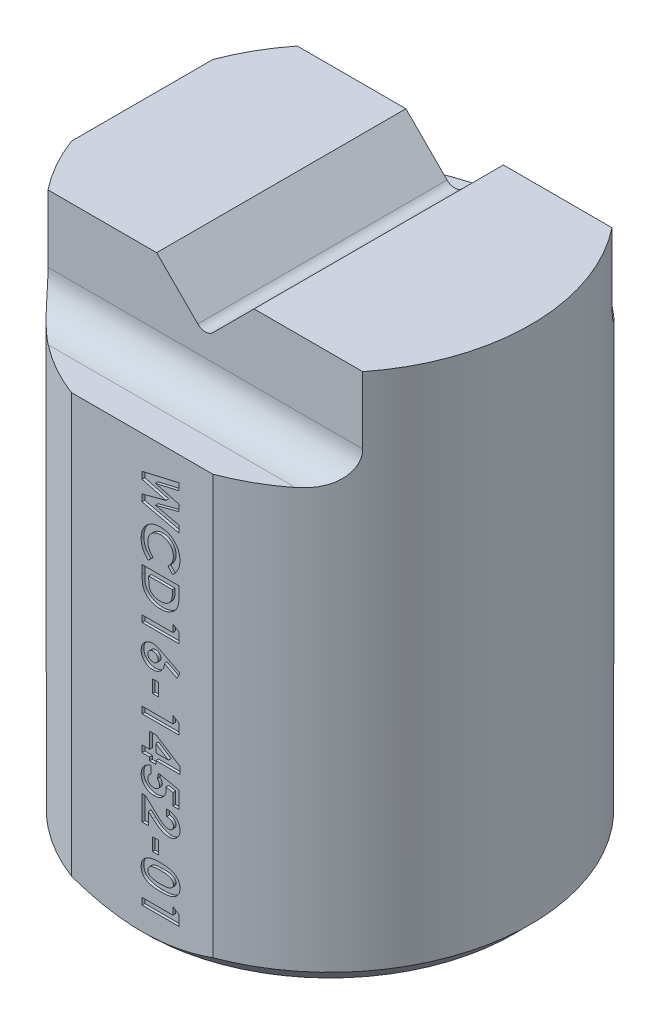
from build123d import *

# Parameters (mm, degrees)
SALIENTE_EXTRUIR1_DEPTH = 50.8
CORTAR_EXTRUIR1_DEPTH   = 66.566945218
CORTAR_EXTRUIR2_DEPTH   = 63.397192666
CHAFL_N1_SIZE           = 1.5875
CROQUIS4_W              = 0.583333334
CROQUIS4_H              = 1.211538461
CORTAR_EXTRUIR3_DEPTH   = 0.254


with BuildPart() as part:
    # Croquis1 → Saliente-Extruir1 (new body)
    with BuildSketch(Plane(origin=(0, 0, 0), x_dir=(1, 0, 0), z_dir=(0, 1, 0))):
        with BuildLine():
            Line((-17.8054, 6.700980227), (-17.8054, -6.700980227))
            ThreePointArc((-17.8054, -6.700980227), (-13.452423669, -13.452423669), (-6.700980227, -17.8054))
            Line((-6.700980227, -17.8054), (6.700980227, -17.8054))
            ThreePointArc((6.700980227, -17.8054), (13.452423669, 13.452423669), (-17.8054, 6.700980227))
        make_face()
    extrude(amount=SALIENTE_EXTRUIR1_DEPTH)

    # Croquis2 → Cortar-Extruir1 (cut, through all)
    with BuildSketch(Plane(origin=(-17.8054, 0, 0), x_dir=(0, 0, -1), z_dir=(1, 0, 0))):
        with BuildLine():
            Line((11.811, 50.8), (11.811, 44.45))
            ThreePointArc((11.811, 44.45), (12.74093597, 42.20493597), (14.986, 41.275))
            Line((14.986, 41.275), (19.0246, 41.275))
            Line((19.0246, 41.275), (19.0246, 50.8))
            Line((19.0246, 50.8), (11.811, 50.8))
        make_face()
        with BuildLine():
            Line((-19.0246, 50.8), (-11.811, 50.8))
            Line((-11.811, 50.8), (-11.811, 44.45))
            ThreePointArc((-11.811, 44.45), (-12.74093597, 42.20493597), (-14.986, 41.275))
            Line((-14.986, 41.275), (-19.0246, 41.275))
            Line((-19.0246, 41.275), (-19.0246, 50.8))
        make_face()
    extrude(amount=CORTAR_EXTRUIR1_DEPTH, mode=Mode.SUBTRACT)

    # Croquis3 → Cortar-Extruir2 (cut, through all)
    with BuildSketch(Plane.XY.offset(11.811)):
        with BuildLine():
            Line((-4.615851646, 50.8), (-0.71842049, 46.902568843))
            ThreePointArc((-0.71842049, 46.902568843), (0, 46.604989333), (0.71842049, 46.902568843))
            Line((0.71842049, 46.902568843), (4.615851646, 50.8))
            Line((4.615851646, 50.8), (-4.615851646, 50.8))
        make_face()
    extrude(amount=-CORTAR_EXTRUIR2_DEPTH, mode=Mode.SUBTRACT)

    # Chaflán1
    chafl_n1_edges = [part.edges().sort_by_distance(p)[0] for p in [
        (13.452423669, 0, -13.452423669),
    ]]
    chamfer(chafl_n1_edges, length=CHAFL_N1_SIZE)
    chafl_n1_2_edges = [part.edges().sort_by_distance(p)[0] for p in [
        (-13.452423669, 0, 13.452423669),
    ]]
    chamfer(chafl_n1_2_edges, length=CHAFL_N1_SIZE - 0.0001)  # a hair under: the kernel refuses the full size

    # Croquis4 → Cortar-Extruir3 (cut)
    # profile 1 of 13: a face of its own
    with BuildSketch(Plane.XY.offset(17.8054)):
        Polygon((3.5, 38.967628205), (3.5, 38.319090545), (1.26552484, 37.800961538), (3.5, 37.207111378), (3.5, 36.596434295), (1.26552484, 36.006089744), (3.5, 35.489362981), (3.5, 34.839423077), (0, 35.64921875), (0, 36.30546875), (2.262520032, 36.903525641), (0, 37.505088141), (0, 38.156430288), align=None)
    # profile 2 of 13: a face of its own
    with BuildSketch(Plane.XY.offset(17.8054)):
        with BuildLine():
            Line((2.892828526, 31.1375), (2.452524038, 31.598137019))
            add(Edge.make_bspline(
                [(2.452524038, 31.598137019), (2.492979524, 31.637170164), (2.572130399, 31.713538238), (2.675863197, 31.837118733), (2.763657071, 31.964490199), (2.836680847, 32.094796132), (2.89238701, 32.230047491), (2.93243686, 32.368464151), (2.957375261, 32.510798563), (2.960143016, 32.606950737), (2.961538462, 32.655428686)],
                knots=[0, 0, 0, 0, 1.115306757, 2.182089883, 3.196083701, 4.1824169, 5.141279108, 6.092660653, 7.038358735, 8, 8, 8, 8], degree=3))
            add(Edge.make_bspline(
                [(2.961538462, 32.655428686), (2.960417785, 32.695909815), (2.958206253, 32.775794864), (2.941993543, 32.893087048), (2.914423124, 33.005283085), (2.876425979, 33.112767038), (2.82725969, 33.215222632), (2.766962311, 33.312864677), (2.696078413, 33.405452441), (2.614974752, 33.491762893), (2.526362907, 33.570716661), (2.431814281, 33.640477342), (2.331545478, 33.698913103), (2.226571947, 33.746870382), (2.116407818, 33.784227248), (2.00112726, 33.810904744), (1.88059298, 33.826334294), (1.798654675, 33.828637258), (1.757011218, 33.829807692)],
                knots=[0, 0, 0, 0, 1.035432265, 2.043311493, 3.022114605, 3.98653278, 4.95457646, 5.923598177, 6.917315552, 7.932509744, 8.948865224, 9.949768934, 10.933144597, 11.912367597, 12.897413939, 13.903909035, 14.934704909, 16, 16, 16, 16], degree=3))
            add(Edge.make_bspline(
                [(1.757011218, 33.829807692), (1.727782778, 33.829470816), (1.670172922, 33.828806826), (1.584954517, 33.821522842), (1.502262614, 33.809826582), (1.422268601, 33.792784102), (1.344662956, 33.771853521), (1.269466523, 33.745841133), (1.196724484, 33.714948931), (1.12657402, 33.680052115), (1.059824514, 33.640667682), (0.996460477, 33.597207297), (0.937288684, 33.54924508), (0.88028502, 33.499021827), (0.828853399, 33.443135332), (0.780011923, 33.384181834), (0.735421452, 33.320906027), (0.693872229, 33.254723726), (0.657782788, 33.185035396), (0.625091416, 33.113739338), (0.598541484, 33.039752533), (0.577139731, 32.963976356), (0.55894076, 32.886681457), (0.547735089, 32.807111862), (0.539249168, 32.725957327), (0.538725212, 32.671110484), (0.538461538, 32.643509615)],
                knots=[0, 0, 0, 0, 1.103757074, 2.175527871, 3.227929046, 4.25632503, 5.262816555, 6.262237806, 7.259082723, 8.246028863, 9.219500025, 10.184246818, 11.145149257, 12.095245763, 13.050780899, 14.010384931, 14.985255937, 15.972438916, 16.959582425, 17.947317807, 18.933039374, 19.924907969, 20.920697008, 21.929431285, 22.958016685, 24, 24, 24, 24], degree=3))
            add(Edge.make_bspline(
                [(0.538461538, 32.643509615), (0.539817719, 32.596694485), (0.542482261, 32.504714926), (0.56325883, 32.369709945), (0.597644399, 32.240898309), (0.637843765, 32.137813751), (0.677644891, 32.057193711), (0.714973074, 31.996371904), (0.756009935, 31.933059587), (0.803284918, 31.868657145), (0.855874443, 31.802460459), (0.915002606, 31.735680998), (0.97870158, 31.666596612), (1.024165677, 31.621340609), (1.047475962, 31.598137019)],
                knots=[0, 0, 0, 0, 1.404522537, 2.759521553, 4.088271485, 5.398566954, 6.072955186, 6.783849712, 7.538645654, 8.336900766, 9.180343671, 10.075042757, 11.013038782, 12, 12, 12, 12], degree=3))
            Line((1.047475962, 31.598137019), (0.578425481, 31.151522436))
            add(Edge.make_bspline(
                [(0.578425481, 31.151522436), (0.548114978, 31.182917037), (0.488955358, 31.244192584), (0.404954238, 31.336625052), (0.329469819, 31.428941166), (0.259762693, 31.518910869), (0.197862411, 31.608007578), (0.143711292, 31.696223168), (0.095925279, 31.782554387), (0.055360592, 31.868810154), (0.020697132, 31.955675175), (-0.008536317, 32.045012484), (-0.034055114, 32.136864768), (-0.054137091, 32.231992751), (-0.07048521, 32.32997198), (-0.081287688, 32.431117299), (-0.088778526, 32.534956123), (-0.089419276, 32.605167776), (-0.08974359, 32.640705128)],
                knots=[0, 0, 0, 0, 1.244537013, 2.429070097, 3.56066612, 4.644477994, 5.67429546, 6.652817684, 7.595405349, 8.486886006, 9.369351459, 10.26090686, 11.166404474, 12.086719576, 13.0323422, 13.998023148, 14.9867073, 16, 16, 16, 16], degree=3))
            add(Edge.make_bspline(
                [(-0.08974359, 32.640705128), (-0.088076654, 32.705980326), (-0.084814924, 32.833705743), (-0.06073091, 33.020902058), (-0.020087909, 33.198881066), (0.036611619, 33.367962569), (0.110235654, 33.527629107), (0.19956996, 33.678381397), (0.305462418, 33.819968389), (0.426335327, 33.951171742), (0.559857392, 34.069814233), (0.703168522, 34.174799001), (0.85729787, 34.26126045), (1.018943889, 34.334618545), (1.190633727, 34.389589294), (1.37081597, 34.429603154), (1.560263841, 34.45395138), (1.689630923, 34.456641064), (1.755608974, 34.458012821)],
                knots=[0, 0, 0, 0, 1.07798487, 2.109316747, 3.111276023, 4.08905949, 5.049398091, 6.009992678, 6.978127636, 7.964347882, 8.951383687, 9.924270623, 10.892397886, 11.86520058, 12.851549246, 13.863953586, 14.910602472, 16, 16, 16, 16], degree=3))
            add(Edge.make_bspline(
                [(1.755608974, 34.458012821), (1.798636408, 34.457407916), (1.883906264, 34.456209144), (2.009629506, 34.444609881), (2.131830903, 34.426365787), (2.250134535, 34.40127829), (2.365199642, 34.368914293), (2.47626848, 34.329138706), (2.583801292, 34.281775798), (2.687110508, 34.227034578), (2.786768715, 34.166428659), (2.881038016, 34.098439982), (2.970932337, 34.025151646), (3.055281654, 33.944756846), (3.13441781, 33.858350333), (3.209311214, 33.766170135), (3.278558749, 33.667102287), (3.342500577, 33.562571347), (3.400908825, 33.454218516), (3.451128993, 33.342801508), (3.494305026, 33.229344983), (3.529436028, 33.113897574), (3.555863311, 32.995924275), (3.575825508, 32.876376954), (3.586993704, 32.754265126), (3.588821121, 32.672276654), (3.58974359, 32.630889423)],
                knots=[0, 0, 0, 0, 1.072042128, 2.124525481, 3.143421661, 4.149789678, 5.136208088, 6.119957821, 7.087418232, 8.061778743, 9.031690376, 9.991741907, 10.955971237, 11.919971873, 12.892764515, 13.874218568, 14.877632952, 15.902487591, 16.926514439, 17.94307752, 18.945815567, 19.949956505, 20.947454389, 21.956649761, 22.968530506, 24, 24, 24, 24], degree=3))
            add(Edge.make_bspline(
                [(3.58974359, 32.630889423), (3.589214692, 32.595581941), (3.588162395, 32.525334076), (3.579390354, 32.420723217), (3.565613953, 32.316948987), (3.544828298, 32.214382929), (3.520153099, 32.112291386), (3.487844329, 32.012015955), (3.451830117, 31.911974737), (3.408782479, 31.81373673), (3.361792095, 31.717164809), (3.308479797, 31.624521322), (3.252126365, 31.534250794), (3.189396556, 31.448353565), (3.122565697, 31.365220597), (3.051321984, 31.285286597), (2.974477576, 31.209253034), (2.920182466, 31.161538592), (2.892828526, 31.1375)],
                knots=[0, 0, 0, 0, 0.996412454, 1.982464992, 2.961075852, 3.949442424, 4.934965278, 5.923860011, 6.921385422, 7.934793307, 8.949617135, 9.951082467, 10.950285876, 11.951772932, 12.951063433, 13.960125323, 14.972308753, 16, 16, 16, 16], degree=3))
        make_face()
    # profile 3 of 13: a face of its own
    with BuildSketch(Plane.XY.offset(17.8054)):
        with BuildLine():
            Line((3.5, 30.509294872), (3.5, 29.717728365))
            add(Edge.make_bspline(
                [(3.5, 29.717728365), (3.499568591, 29.656016661), (3.498734672, 29.53672724), (3.489339229, 29.363900309), (3.474888157, 29.203193825), (3.455013137, 29.05450167), (3.428696427, 28.918137098), (3.395741478, 28.794248065), (3.357455945, 28.682308902), (3.312963548, 28.581004707), (3.260756274, 28.4887806), (3.202110394, 28.401830656), (3.13613819, 28.319152527), (3.062688192, 28.240287642), (2.982248191, 28.165043911), (2.893198621, 28.095187589), (2.79784594, 28.02847914), (2.695859214, 27.966000913), (2.587439788, 27.910387489), (2.474294106, 27.860885305), (2.356348631, 27.819641046), (2.233766215, 27.786058506), (2.106901952, 27.759308156), (1.975514115, 27.740586743), (1.839720404, 27.729014174), (1.747686487, 27.727840146), (1.700921474, 27.72724359)],
                knots=[0, 0, 0, 0, 1.443473934, 2.790251435, 4.047465151, 5.217279069, 6.298047006, 7.293970747, 8.213772908, 9.063072335, 9.878180301, 10.689410498, 11.514196541, 12.349783386, 13.208549609, 14.087984609, 14.994942826, 15.929749014, 16.883358292, 17.843153412, 18.816615524, 19.8034191, 20.814532747, 21.847477555, 22.906243002, 24, 24, 24, 24], degree=3))
            add(Edge.make_bspline(
                [(1.700921474, 27.72724359), (1.63493291, 27.728805539), (1.505030559, 27.731880327), (1.314401533, 27.757783426), (1.13166008, 27.799670677), (0.958256772, 27.858591799), (0.795659909, 27.931555461), (0.647126596, 28.018938456), (0.512354038, 28.118230651), (0.39357849, 28.230313159), (0.29086397, 28.351479513), (0.203922209, 28.477889092), (0.13413216, 28.609428337), (0.09056056, 28.725578069), (0.063150713, 28.826575295), (0.047312403, 28.915127839), (0.032225651, 29.015841033), (0.021020219, 29.129362559), (0.010749742, 29.2555452), (0.005237984, 29.394476259), (0.000634556, 29.545922723), (0.000217061, 29.651117288), (0, 29.705809295)],
                knots=[0, 0, 0, 0, 1.315357893, 2.589359008, 3.828307697, 5.048525571, 6.235260212, 7.375784434, 8.478395391, 9.566323578, 10.624275077, 11.640246088, 12.619991216, 13.585951757, 14.107079058, 14.704817694, 15.378369799, 16.137463096, 16.978827496, 17.902494345, 18.909479843, 20, 20, 20, 20], degree=3))
            Line((0, 29.705809295), (0, 30.509294872))
            Line((0, 30.509294872), (3.5, 30.509294872))
        make_face()
        with BuildLine():
            Line((2.871794872, 29.881089744), (0.628205128, 29.881089744))
            Line((0.628205128, 29.881089744), (0.628205128, 29.552964744))
            add(Edge.make_bspline(
                [(0.628205128, 29.552964744), (0.628276669, 29.513922908), (0.628414266, 29.43883246), (0.63496812, 29.330418852), (0.641546381, 29.230163754), (0.654032142, 29.138343143), (0.667940402, 29.05428878), (0.687295649, 28.97915535), (0.707626696, 28.911394027), (0.733510639, 28.851832503), (0.76264474, 28.797279), (0.796778717, 28.746768689), (0.834683209, 28.698012088), (0.877473052, 28.651920786), (0.924581586, 28.608320167), (0.9762517, 28.567468853), (1.032325129, 28.528819027), (1.093100774, 28.493372761), (1.157927403, 28.4609512), (1.226213671, 28.432307593), (1.29833184, 28.408127144), (1.374249989, 28.389764449), (1.453497013, 28.374121852), (1.536582444, 28.362826697), (1.623234838, 28.356673058), (1.682215613, 28.355860811), (1.712139423, 28.355448718)],
                knots=[0, 0, 0, 0, 1.502785267, 2.890356349, 4.180881464, 5.369512404, 6.456827674, 7.458527365, 8.354953631, 9.177280646, 9.954299195, 10.732931168, 11.52132839, 12.330004022, 13.151395147, 13.990341431, 14.86389591, 15.771318928, 16.696852441, 17.652725226, 18.620174565, 19.621874256, 20.657747019, 21.729235313, 22.847930884, 24, 24, 24, 24], degree=3))
            add(Edge.make_bspline(
                [(1.712139423, 28.355448718), (1.75799226, 28.356285848), (1.847401739, 28.357918186), (1.977628596, 28.373660105), (2.100256692, 28.399284947), (2.214830919, 28.435849127), (2.321673292, 28.481939408), (2.419878629, 28.53963214), (2.511096645, 28.606444448), (2.56460806, 28.659277799), (2.591346154, 28.685677083)],
                knots=[0, 0, 0, 0, 1.13821349, 2.219428113, 3.251817212, 4.244760574, 5.201143372, 6.134805572, 7.068016741, 8, 8, 8, 8], degree=3))
            add(Edge.make_bspline(
                [(2.591346154, 28.685677083), (2.614130624, 28.711709277), (2.660665325, 28.764877086), (2.716425797, 28.858222287), (2.765416837, 28.961083864), (2.804261268, 29.075814981), (2.834981101, 29.201306813), (2.856167818, 29.338306792), (2.869782177, 29.486081254), (2.8711096, 29.588455958), (2.871794872, 29.64130609)],
                knots=[0, 0, 0, 0, 0.813307809, 1.661089106, 2.549956539, 3.493439533, 4.508053171, 5.589449661, 6.755572447, 8, 8, 8, 8], degree=3))
            Line((2.871794872, 29.64130609), (2.871794872, 29.881089744))
        make_face(mode=Mode.SUBTRACT)
    # profile 4 of 13: a face of its own
    with BuildSketch(Plane.XY.offset(17.8054)):
        Polygon((3.5, 26.723938301), (3.5, 25.752884615), (0, 25.752884615), (0, 26.381089744), (2.916666667, 26.381089744), (2.916666667, 27.099038462), align=None)
    # profile 5 of 13: a face of its own
    with BuildSketch(Plane.XY.offset(17.8054)):
        with BuildLine():
            Line((3.58974359, 23.388701923), (3.307892628, 22.83271234))
            Line((3.307892628, 22.83271234), (2.108974359, 23.442688301))
            add(Edge.make_bspline(
                [(2.108974359, 23.442688301), (2.108041348, 23.406651494), (2.106203629, 23.335671092), (2.091350882, 23.231237833), (2.065674043, 23.131397693), (2.031639463, 23.035143989), (1.985930683, 22.943653331), (1.931557705, 22.855452211), (1.86524401, 22.772822437), (1.791771954, 22.693869378), (1.710375475, 22.622077767), (1.622912373, 22.559714061), (1.531510636, 22.505365192), (1.434125384, 22.463116568), (1.33237089, 22.429037421), (1.225840396, 22.404447817), (1.114225415, 22.39041876), (1.038400302, 22.388484621), (0.999799679, 22.3875)],
                knots=[0, 0, 0, 0, 1.013260694, 1.995783107, 2.958651975, 3.908806537, 4.861209129, 5.829647963, 6.817170299, 7.835534541, 8.860094905, 9.863329007, 10.853101798, 11.844815043, 12.84250023, 13.867713965, 14.914507806, 16, 16, 16, 16], degree=3))
            add(Edge.make_bspline(
                [(0.999799679, 22.3875), (0.962591212, 22.388422995), (0.889046028, 22.390247359), (0.781023541, 22.405318199), (0.677395029, 22.429698068), (0.57830761, 22.464455063), (0.483607295, 22.508896062), (0.392393311, 22.562063057), (0.306677881, 22.626674061), (0.226025072, 22.699727752), (0.152235446, 22.779663641), (0.087358024, 22.864473463), (0.033126312, 22.953766137), (-0.012418212, 23.046395576), (-0.046446274, 23.144035754), (-0.072120187, 23.245275759), (-0.086937705, 23.350869736), (-0.088800811, 23.422544726), (-0.08974359, 23.458814103)],
                knots=[0, 0, 0, 0, 1.049811581, 2.075027318, 3.071773918, 4.050170609, 5.032849337, 6.020452587, 7.024397577, 8.056465645, 9.088112048, 10.090756029, 11.064784855, 12.032427273, 12.998382039, 13.977467781, 14.976547025, 16, 16, 16, 16], degree=3))
            add(Edge.make_bspline(
                [(-0.08974359, 23.458814103), (-0.088969855, 23.496740804), (-0.08744841, 23.57131853), (-0.070412233, 23.680444407), (-0.044766644, 23.785105516), (-0.0081491, 23.884713643), (0.038476396, 23.979888222), (0.096170758, 24.069508744), (0.164297771, 24.154330137), (0.241324685, 24.233448082), (0.325697131, 24.304727454), (0.413297697, 24.368302697), (0.504263848, 24.422087434), (0.598498322, 24.465624925), (0.695700839, 24.499593885), (0.79605588, 24.523229354), (0.899297254, 24.538630042), (0.969362693, 24.540435422), (1.004707532, 24.541346154)],
                knots=[0, 0, 0, 0, 1.063775006, 2.091769615, 3.092589432, 4.084662827, 5.064601646, 6.061867366, 7.070035304, 8.113879863, 9.156342271, 10.166834137, 11.149076039, 12.117706134, 13.076241869, 14.034148791, 15.008317125, 16, 16, 16, 16], degree=3))
            add(Edge.make_bspline(
                [(1.004707532, 24.541346154), (1.032077976, 24.540864941), (1.086971218, 24.539899836), (1.169170865, 24.530201112), (1.251586278, 24.515455645), (1.321131014, 24.498363718), (1.379938366, 24.480764178), (1.429705439, 24.463050107), (1.484936007, 24.441097417), (1.545771109, 24.416002242), (1.612137558, 24.386975428), (1.683854458, 24.354168607), (1.761464902, 24.317500104), (1.81477126, 24.291350412), (1.842548077, 24.277724359)],
                knots=[0, 0, 0, 0, 1.110454016, 2.227089276, 3.35462975, 4.507227546, 5.131400587, 5.845402449, 6.650387134, 7.543487832, 8.516250726, 9.590168902, 10.744287919, 12, 12, 12, 12], degree=3))
            Line((1.842548077, 24.277724359), (3.58974359, 23.388701923))
        make_face()
        with BuildLine():
            add(Edge.make_bspline(
                [(1.525641026, 23.472836538), (1.524258421, 23.502979732), (1.521552845, 23.561966006), (1.493218739, 23.645835667), (1.448769578, 23.722305768), (1.386865525, 23.788590997), (1.312887751, 23.844032493), (1.228506218, 23.884772849), (1.134846975, 23.909280437), (1.069361994, 23.911826619), (1.035556891, 23.913141026)],
                knots=[0, 0, 0, 0, 0.981744412, 1.921144944, 2.858899012, 3.85339082, 4.86292663, 5.863643845, 6.897155691, 8, 8, 8, 8], degree=3))
            add(Edge.make_bspline(
                [(1.035556891, 23.913141026), (1.001748788, 23.911567065), (0.935989767, 23.908505606), (0.841223383, 23.883295426), (0.75527079, 23.840671713), (0.680393914, 23.782451662), (0.617727229, 23.714502847), (0.571951897, 23.638513391), (0.54364568, 23.556334758), (0.540201518, 23.499464062), (0.538461538, 23.470733173)],
                knots=[0, 0, 0, 0, 1.098593804, 2.136838383, 3.163662877, 4.199231707, 5.205701886, 6.153612227, 7.067210972, 8, 8, 8, 8], degree=3))
            add(Edge.make_bspline(
                [(0.538461538, 23.470733173), (0.540235082, 23.440392332), (0.54371331, 23.380888674), (0.570792611, 23.295050744), (0.61603715, 23.21663728), (0.678059004, 23.14730461), (0.752161771, 23.087749164), (0.838966412, 23.046542812), (0.934199894, 23.019938107), (1.001013724, 23.017147757), (1.035556891, 23.015705128)],
                knots=[0, 0, 0, 0, 0.96921794, 1.900804717, 2.848419905, 3.844199796, 4.861108892, 5.867439427, 6.897452859, 8, 8, 8, 8], degree=3))
            add(Edge.make_bspline(
                [(1.035556891, 23.015705128), (1.069373239, 23.0172489), (1.134922146, 23.020241315), (1.228549932, 23.045520061), (1.313139774, 23.086902656), (1.387105723, 23.143904956), (1.449311116, 23.212453938), (1.493218153, 23.292309006), (1.521633261, 23.379791743), (1.524282364, 23.441293675), (1.525641026, 23.472836538)],
                knots=[0, 0, 0, 0, 1.083506644, 2.10024676, 3.086160022, 4.086481818, 5.079696241, 6.033050226, 6.991198733, 8, 8, 8, 8], degree=3))
        make_face(mode=Mode.SUBTRACT)
    # profile 6 of 13: a face of its own
    with BuildSketch(Plane.XY.offset(17.8054)):
        with Locations((1.278846154, 21.018910256)):
            Rectangle(CROQUIS4_W, CROQUIS4_H)
    # profile 7 of 13: a face of its own
    with BuildSketch(Plane.XY.offset(17.8054)):
        Polygon((3.5, 19.230348558), (3.5, 18.259294872), (0, 18.259294872), (0, 18.8875), (2.916666667, 18.8875), (2.916666667, 19.605448718), align=None)
    # profile 8 of 13: a face of its own
    with BuildSketch(Plane.XY.offset(17.8054)):
        Polygon((3.58974359, 15.728245192), (3.58974359, 15.073397436), (1.301282051, 15.073397436), (1.301282051, 14.759294872), (0.717948718, 14.759294872), (0.717948718, 15.073397436), (0, 15.073397436), (0, 15.701602564), (0.717948718, 15.701602564), (0.717948718, 17.182371795), (1.353866186, 17.182371795), align=None)
        Polygon((1.301282051, 15.701602564), (2.492487981, 15.701602564), (1.301282051, 16.476342147), align=None, mode=Mode.SUBTRACT)
    # profile 9 of 13: a face of its own
    with BuildSketch(Plane.XY.offset(17.8054)):
        with BuildLine():
            Line((3.5, 13.750380609), (3.5, 12.156730769))
            Line((3.5, 12.156730769), (2.916666667, 12.156730769))
            Line((2.916666667, 12.156730769), (2.916666667, 13.252584135))
            Line((2.916666667, 13.252584135), (2.254807692, 13.389302885))
            add(Edge.make_bspline(
                [(2.254807692, 13.389302885), (2.260011766, 13.370675673), (2.270337098, 13.33371768), (2.280347931, 13.278322814), (2.287192332, 13.224709009), (2.288045062, 13.189736806), (2.288461538, 13.17265625)],
                knots=[0, 0, 0, 0, 1.054652254, 2.092520994, 3.068380062, 4, 4, 4, 4], degree=3))
            add(Edge.make_bspline(
                [(2.288461538, 13.17265625), (2.287608748, 13.135439912), (2.285927709, 13.062078312), (2.26996917, 12.9547596), (2.244834954, 12.851995593), (2.208988378, 12.754100762), (2.162333132, 12.661170735), (2.105893363, 12.573092863), (2.039569942, 12.489759046), (1.963321345, 12.412649642), (1.879598659, 12.341798302), (1.789043716, 12.280197102), (1.69294774, 12.227585833), (1.590713401, 12.185740649), (1.4829828, 12.152712862), (1.3696869, 12.128846246), (1.250691427, 12.114732723), (1.169509324, 12.112829601), (1.128104968, 12.111858974)],
                knots=[0, 0, 0, 0, 1.01440847, 1.999622559, 2.951875003, 3.895578053, 4.836219714, 5.782137149, 6.743708247, 7.735272588, 8.734977101, 9.730283169, 10.717124674, 11.717316708, 12.737475749, 13.78628267, 14.87096371, 16, 16, 16, 16], degree=3))
            add(Edge.make_bspline(
                [(1.128104968, 12.111858974), (1.08622803, 12.113038059), (1.00359259, 12.115364737), (0.882133217, 12.13073582), (0.765560743, 12.157335285), (0.654525629, 12.195709541), (0.548081434, 12.243174382), (0.446948801, 12.30213349), (0.35083445, 12.371568076), (0.261051547, 12.451318254), (0.178974831, 12.537981251), (0.106775241, 12.630266259), (0.046019009, 12.727513746), (-0.00308208, 12.829728956), (-0.041930045, 12.936324693), (-0.070209494, 13.047333511), (-0.08642619, 13.163294844), (-0.088625639, 13.242017524), (-0.08974359, 13.28203125)],
                knots=[0, 0, 0, 0, 1.06812338, 2.107719657, 3.117068656, 4.112431602, 5.099639003, 6.085279307, 7.092884053, 8.119131772, 9.143854758, 10.133578715, 11.102895672, 12.062725997, 13.020721913, 13.992309192, 14.979516593, 16, 16, 16, 16], degree=3))
            add(Edge.make_bspline(
                [(-0.08974359, 13.28203125), (-0.088829036, 13.317814334), (-0.087025345, 13.388386063), (-0.075938907, 13.492335121), (-0.056337982, 13.592553557), (-0.027970368, 13.68850932), (0.006943689, 13.781212025), (0.050610316, 13.869590002), (0.10219804, 13.954128903), (0.160765386, 14.034588669), (0.226739229, 14.109661945), (0.298958967, 14.178180876), (0.376514305, 14.240560285), (0.460362042, 14.29546535), (0.550378295, 14.34272396), (0.645502204, 14.38463386), (0.746727166, 14.418937533), (0.816901933, 14.436345659), (0.852564103, 14.445192308)],
                knots=[0, 0, 0, 0, 1.054957082, 2.080596141, 3.077793124, 4.061112343, 5.027190972, 5.994718051, 6.962465889, 7.943658696, 8.924948258, 9.904494768, 10.875059, 11.855380583, 12.854004648, 13.869083016, 14.917087635, 16, 16, 16, 16], degree=3))
            Line((0.852564103, 14.445192308), (0.852564103, 13.72724359))
            add(Edge.make_bspline(
                [(0.852564103, 13.72724359), (0.827848753, 13.714121698), (0.779817292, 13.688620799), (0.716096066, 13.640073497), (0.661445198, 13.585740592), (0.616368773, 13.525548753), (0.582220926, 13.460353514), (0.556086292, 13.392339117), (0.541294896, 13.320294157), (0.53941223, 13.27111041), (0.538461538, 13.246274038)],
                knots=[0, 0, 0, 0, 1.105084364, 2.147605349, 3.154024051, 4.144789344, 5.108147638, 6.055727127, 7.018198351, 8, 8, 8, 8], degree=3))
            add(Edge.make_bspline(
                [(0.538461538, 13.246274038), (0.539113117, 13.228961863), (0.540395107, 13.194899867), (0.547172003, 13.144712552), (0.560023964, 13.096815633), (0.577764849, 13.05080985), (0.600183474, 13.006558669), (0.627728605, 12.964284997), (0.660226953, 12.924200704), (0.69715222, 12.886439368), (0.738422612, 12.852356099), (0.782478811, 12.822207493), (0.829282437, 12.7964172), (0.879349498, 12.776370446), (0.932123436, 12.760193315), (0.987670684, 12.748209538), (1.046118918, 12.741064783), (1.086017449, 12.74040213), (1.106370192, 12.740064103)],
                knots=[0, 0, 0, 0, 0.978584799, 1.925382083, 2.854237347, 3.773848163, 4.706917643, 5.651871472, 6.619075428, 7.618203006, 8.630937754, 9.638147826, 10.630884984, 11.643619732, 12.679505692, 13.746568031, 14.850495961, 16, 16, 16, 16], degree=3))
            add(Edge.make_bspline(
                [(1.106370192, 12.740064103), (1.126265678, 12.740347762), (1.165020309, 12.740900305), (1.221615906, 12.748716555), (1.27579543, 12.758510933), (1.32705193, 12.77434388), (1.375957954, 12.79366124), (1.421379426, 12.818915151), (1.465398049, 12.846328442), (1.504819713, 12.87971389), (1.541290984, 12.915001289), (1.573132471, 12.953016974), (1.599572491, 12.993293259), (1.622651701, 13.034610631), (1.639449088, 13.078609963), (1.651016614, 13.124304055), (1.65950446, 13.171644272), (1.660003149, 13.203934029), (1.66025641, 13.220332532)],
                knots=[0, 0, 0, 0, 1.166407123, 2.272056916, 3.347877023, 4.393466184, 5.414668253, 6.42708463, 7.438943561, 8.452102724, 9.450960385, 10.414941083, 11.35441816, 12.274885341, 13.186627518, 14.108013686, 15.039145946, 16, 16, 16, 16], degree=3))
            add(Edge.make_bspline(
                [(1.66025641, 13.220332532), (1.659580522, 13.238145116), (1.658225896, 13.273845355), (1.647203668, 13.326886975), (1.629365569, 13.37928906), (1.604755084, 13.431343021), (1.572547724, 13.482532131), (1.534772184, 13.534207296), (1.488683712, 13.584638837), (1.454356913, 13.616704613), (1.436598558, 13.633293269)],
                knots=[0, 0, 0, 0, 0.88288272, 1.769486374, 2.674910571, 3.623812639, 4.617874466, 5.670434592, 6.794841017, 8, 8, 8, 8], degree=3))
            Line((1.436598558, 13.633293269), (1.557892628, 14.161939103))
            Line((1.557892628, 14.161939103), (3.5, 13.750380609))
        make_face()
    # profile 10 of 13: a face of its own
    with BuildSketch(Plane.XY.offset(17.8054)):
        with BuildLine():
            Line((2.333333333, 10.990064103), (2.333333333, 11.618269231))
            add(Edge.make_bspline(
                [(2.333333333, 11.618269231), (2.380853728, 11.615556109), (2.473705726, 11.610254832), (2.608576225, 11.589167694), (2.736014017, 11.560911651), (2.855573308, 11.523200211), (2.967210656, 11.47581332), (3.071306638, 11.419970364), (3.167313186, 11.354244681), (3.254767303, 11.280035132), (3.333223199, 11.19860159), (3.402787125, 11.111634696), (3.460189525, 11.017804172), (3.507426387, 10.918824381), (3.545166444, 10.814712176), (3.570398727, 10.704482492), (3.587486275, 10.589089757), (3.588981504, 10.510094086), (3.58974359, 10.469831731)],
                knots=[0, 0, 0, 0, 1.199038563, 2.342849363, 3.436047546, 4.486744587, 5.497670872, 6.488682221, 7.459191391, 8.424610317, 9.374430501, 10.305433194, 11.225809216, 12.140057399, 13.06607119, 14.010487599, 14.985989317, 16, 16, 16, 16], degree=3))
            add(Edge.make_bspline(
                [(3.58974359, 10.469831731), (3.588198998, 10.420411346), (3.585183592, 10.323931174), (3.559538073, 10.18371961), (3.516390467, 10.052646709), (3.456703735, 9.930708418), (3.380526719, 9.81936849), (3.288902704, 9.719352217), (3.182150587, 9.631284293), (3.062447571, 9.55685038), (2.935499331, 9.496016264), (2.804764037, 9.452512105), (2.672966082, 9.424106778), (2.584241289, 9.421063255), (2.540164263, 9.419551282)],
                knots=[0, 0, 0, 0, 1.075208937, 2.099059817, 3.090102131, 4.070747506, 5.044426497, 6.016695572, 7.013986309, 8.047248753, 9.078128699, 10.07077592, 11.041593041, 12, 12, 12, 12], degree=3))
            add(Edge.make_bspline(
                [(2.540164263, 9.419551282), (2.513502321, 9.42013848), (2.459838417, 9.421320365), (2.378631761, 9.429538166), (2.295913285, 9.441866487), (2.211753927, 9.460454612), (2.126130033, 9.48363545), (2.038785609, 9.511757457), (1.950214893, 9.545471527), (1.85942487, 9.584220606), (1.76610541, 9.630429711), (1.668921017, 9.684310469), (1.567585289, 9.746979281), (1.462838731, 9.81911646), (1.352410922, 9.897794298), (1.239144983, 9.986744233), (1.121185807, 10.083362478), (1.042387564, 10.152010204), (1.001903045, 10.187279647)],
                knots=[0, 0, 0, 0, 0.728291422, 1.465870735, 2.227967504, 3.011895603, 3.818808047, 4.650669213, 5.517493715, 6.406970765, 7.346374078, 8.360901659, 9.441709605, 10.599840149, 11.834858619, 13.145178554, 14.533265854, 16, 16, 16, 16], degree=3))
            Line((1.001903045, 10.187279647), (0.583333333, 10.552564103))
            Line((0.583333333, 10.552564103), (0.583333333, 9.374679487))
            Line((0.583333333, 9.374679487), (0, 9.374679487))
            Line((0, 9.374679487), (0, 11.708012821))
            Line((0, 11.708012821), (0.318309295, 11.708012821))
            Line((0.318309295, 11.708012821), (1.421173878, 10.671754808))
            add(Edge.make_bspline(
                [(1.421173878, 10.671754808), (1.453344781, 10.641752475), (1.515650278, 10.583646855), (1.60715253, 10.500968545), (1.693985982, 10.426151978), (1.777075237, 10.360748536), (1.853725216, 10.30132593), (1.926246247, 10.250533811), (1.993982712, 10.20790747), (2.075661059, 10.161630531), (2.173077022, 10.117682651), (2.285304206, 10.077357812), (2.392567547, 10.052777031), (2.462462646, 10.049384106), (2.49599359, 10.04775641)],
                knots=[0, 0, 0, 0, 1.246127091, 2.413378631, 3.493388633, 4.492180848, 5.408488754, 6.240484944, 6.999099869, 7.674939598, 8.898438119, 10.020720584, 11.050475521, 12, 12, 12, 12], degree=3))
            add(Edge.make_bspline(
                [(2.49599359, 10.04775641), (2.528441842, 10.048954396), (2.591315534, 10.051275684), (2.680492825, 10.077420614), (2.761846473, 10.116539888), (2.831670598, 10.173333657), (2.889548302, 10.241882284), (2.931960385, 10.321547179), (2.956887977, 10.410865634), (2.959958752, 10.473412664), (2.961538462, 10.505588942)],
                knots=[0, 0, 0, 0, 1.061596218, 2.057012874, 3.024113775, 4.006148568, 4.986025304, 5.949989669, 6.945406325, 8, 8, 8, 8], degree=3))
            add(Edge.make_bspline(
                [(2.961538462, 10.505588942), (2.960950642, 10.522208339), (2.959793424, 10.554926291), (2.952090139, 10.603019123), (2.938513903, 10.648782908), (2.920323658, 10.692727022), (2.896212358, 10.734382482), (2.866491338, 10.77364422), (2.831915879, 10.810925908), (2.792594092, 10.846056557), (2.748710967, 10.878030033), (2.700667285, 10.906428759), (2.64849287, 10.929909776), (2.592876502, 10.950583318), (2.533220817, 10.966527743), (2.469882848, 10.978137262), (2.402965636, 10.986963204), (2.356966346, 10.989011666), (2.333333333, 10.990064103)],
                knots=[0, 0, 0, 0, 0.903469896, 1.778625579, 2.63899355, 3.493148037, 4.358286772, 5.247621495, 6.164656832, 7.118446693, 8.109501108, 9.111810964, 10.146451449, 11.215617525, 12.33435995, 13.498009769, 14.714554818, 16, 16, 16, 16], degree=3))
        make_face()
    # profile 11 of 13: a face of its own
    with BuildSketch(Plane.XY.offset(17.8054)):
        with Locations((1.278846154, 8.050961539)):
            Rectangle(CROQUIS4_W, CROQUIS4_H)
    # profile 12 of 13: a face of its own
    with BuildSketch(Plane.XY.offset(17.8054)):
        with BuildLine():
            add(Edge.make_bspline(
                [(3.58974359, 5.728145032), (3.589292236, 5.697737265), (3.588404754, 5.637947471), (3.57879055, 5.549888896), (3.56427042, 5.46506208), (3.544004841, 5.383144778), (3.517238157, 5.304691735), (3.484924891, 5.22907037), (3.446292458, 5.156916638), (3.401901199, 5.088063632), (3.352254725, 5.022190682), (3.294867932, 4.961489252), (3.232282817, 4.903609802), (3.163466306, 4.849512066), (3.087949341, 4.799801721), (3.00673234, 4.753550819), (2.919050821, 4.711355788), (2.824815419, 4.67265843), (2.722597833, 4.638039898), (2.611214164, 4.60896308), (2.490744257, 4.583684539), (2.360560501, 4.563776978), (2.220969987, 4.54748311), (2.071711506, 4.536836877), (1.913202756, 4.529430624), (1.80446315, 4.528832784), (1.748597756, 4.528525641)],
                knots=[0, 0, 0, 0, 0.879087513, 1.728520926, 2.558587148, 3.366762743, 4.166157112, 4.95337177, 5.74258602, 6.530032775, 7.320866164, 8.124307838, 8.942260106, 9.784645725, 10.652593514, 11.554662219, 12.485739241, 13.464770064, 14.499274465, 15.604285219, 16.792026686, 18.057713884, 19.411711354, 20.855437135, 22.384468668, 24, 24, 24, 24], degree=3))
            add(Edge.make_bspline(
                [(1.748597756, 4.528525641), (1.692033771, 4.528859905), (1.582130963, 4.529509374), (1.422167658, 4.53650699), (1.271841986, 4.548557121), (1.131169704, 4.564088498), (1.000224395, 4.585361211), (0.878669388, 4.610277835), (0.766540671, 4.639875601), (0.66411805, 4.675646354), (0.569659208, 4.71401347), (0.482454166, 4.756621054), (0.400936246, 4.800905311), (0.326241474, 4.849550701), (0.258205639, 4.901523383), (0.19620369, 4.956007436), (0.141089362, 5.014163843), (0.091724504, 5.075122872), (0.048513994, 5.140365801), (0.011390259, 5.209605647), (-0.019289021, 5.283309617), (-0.045732667, 5.3604055), (-0.064757589, 5.442264819), (-0.079840809, 5.527623639), (-0.088179421, 5.617435283), (-0.089213643, 5.678583072), (-0.08974359, 5.709915865)],
                knots=[0, 0, 0, 0, 1.643682949, 3.193646483, 4.651618242, 6.025629174, 7.305184366, 8.505292942, 9.630500342, 10.672179876, 11.655924581, 12.591484594, 13.491256898, 14.350247848, 15.17884557, 15.977481787, 16.746098769, 17.504475725, 18.254166354, 19.016819136, 19.783753977, 20.571954997, 21.382401421, 22.223156612, 23.089526058, 24, 24, 24, 24], degree=3))
            add(Edge.make_bspline(
                [(-0.08974359, 5.709915865), (-0.08920114, 5.741247197), (-0.088138488, 5.802624816), (-0.079928099, 5.892687979), (-0.06456648, 5.978691907), (-0.045853396, 6.061313044), (-0.019146432, 6.139825794), (0.012025309, 6.214803735), (0.049361079, 6.285873595), (0.092379878, 6.353080145), (0.141720926, 6.416180014), (0.196844721, 6.476157497), (0.257614734, 6.532878903), (0.324710754, 6.585481669), (0.397237451, 6.634827072), (0.476022902, 6.680401036), (0.560952715, 6.722174192), (0.652144074, 6.761461109), (0.751565081, 6.795571569), (0.86008357, 6.826031785), (0.978723813, 6.850565666), (1.107040012, 6.872055184), (1.245481839, 6.886484039), (1.393410678, 6.898824303), (1.551283014, 6.905728778), (1.659782862, 6.90639022), (1.715645032, 6.906730769)],
                knots=[0, 0, 0, 0, 0.917197984, 1.796777363, 2.643741708, 3.473481078, 4.273990801, 5.068160217, 5.848535553, 6.620952589, 7.401027954, 8.190319769, 9.003592045, 9.831693788, 10.683727512, 11.569696396, 12.49373307, 13.453184301, 14.474457586, 15.568383184, 16.750575061, 18.019320986, 19.375517054, 20.823796471, 22.364701649, 24, 24, 24, 24], degree=3))
            add(Edge.make_bspline(
                [(1.715645032, 6.906730769), (1.793260909, 6.906121311), (1.943021744, 6.904945353), (2.159413126, 6.890424833), (2.359281241, 6.868459236), (2.542867587, 6.838390022), (2.709812826, 6.797890068), (2.860069005, 6.748187854), (2.995123466, 6.691157894), (3.075143503, 6.642638312), (3.113681891, 6.619270833)],
                knots=[0, 0, 0, 0, 1.288526675, 2.486228817, 3.599112392, 4.626206381, 5.5730174, 6.447949553, 7.252518174, 8, 8, 8, 8], degree=3))
            add(Edge.make_bspline(
                [(3.113681891, 6.619270833), (3.151540942, 6.592094811), (3.225562848, 6.538960334), (3.322739774, 6.446053214), (3.405850239, 6.34623661), (3.47301338, 6.237460346), (3.525978238, 6.121444763), (3.563386721, 5.99719381), (3.585182647, 5.865166323), (3.588200572, 5.774500846), (3.58974359, 5.728145032)],
                knots=[0, 0, 0, 0, 1.058512271, 2.069600068, 3.047294572, 4.004278952, 4.967380941, 5.939006123, 6.946246673, 8, 8, 8, 8], degree=3))
        make_face()
        with BuildLine():
            add(Edge.make_bspline(
                [(2.961538462, 5.712720353), (2.960225557, 5.740204133), (2.957651566, 5.794086932), (2.936168077, 5.872154473), (2.902263792, 5.945439102), (2.862300426, 6.001537967), (2.823311379, 6.043338127), (2.789110775, 6.073633334), (2.749110447, 6.100765783), (2.705039384, 6.126944865), (2.65568472, 6.150237231), (2.6022913, 6.173397959), (2.543076573, 6.192267285), (2.479156529, 6.210850688), (2.408729109, 6.227097375), (2.331240444, 6.240811499), (2.246107861, 6.252637518), (2.153537728, 6.262623196), (2.053161486, 6.268971875), (1.945212834, 6.275115762), (1.829468372, 6.277352367), (1.749765973, 6.278126258), (1.708633814, 6.278525641)],
                knots=[0, 0, 0, 0, 1.076821401, 2.111141558, 3.153197101, 4.23200803, 4.796476379, 5.394298193, 6.020090776, 6.690078086, 7.403703365, 8.159894791, 8.971856079, 9.83973388, 10.771758647, 11.806038152, 12.926526118, 14.143777411, 15.458313878, 16.872423957, 18.385946227, 20, 20, 20, 20], degree=3))
            add(Edge.make_bspline(
                [(1.708633814, 6.278525641), (1.655343729, 6.277885966), (1.553156039, 6.276659341), (1.406211953, 6.270210158), (1.272462209, 6.257357841), (1.151082174, 6.241163683), (1.042532416, 6.219102998), (0.946779237, 6.191634273), (0.863113726, 6.161173113), (0.792766273, 6.122980587), (0.732604762, 6.082060641), (0.680562047, 6.03838505), (0.637209833, 5.991192066), (0.600404668, 5.941892311), (0.573074679, 5.888657541), (0.553150238, 5.832579352), (0.541001834, 5.773533259), (0.539313199, 5.733108504), (0.538461538, 5.712720353)],
                knots=[0, 0, 0, 0, 1.772047989, 3.398033405, 4.888860297, 6.238411839, 7.468309579, 8.567754056, 9.549141588, 10.421774021, 11.221426488, 11.965694757, 12.675067502, 13.348095901, 14.005005053, 14.656328889, 15.322321954, 16, 16, 16, 16], degree=3))
            add(Edge.make_bspline(
                [(0.538461538, 5.712720353), (0.539043617, 5.693031099), (0.540183253, 5.654481989), (0.551881469, 5.598268754), (0.570900227, 5.545109524), (0.597803595, 5.495164804), (0.632015344, 5.448255949), (0.673685815, 5.40461222), (0.723230366, 5.36456277), (0.759999749, 5.341229778), (0.778946314, 5.329206731)],
                knots=[0, 0, 0, 0, 0.992283464, 1.942767638, 2.88273346, 3.832339453, 4.79467288, 5.803907806, 6.868395428, 8, 8, 8, 8], degree=3))
            add(Edge.make_bspline(
                [(0.778946314, 5.329206731), (0.804835324, 5.315047247), (0.859122477, 5.285355956), (0.95074824, 5.251084278), (1.053956805, 5.22184791), (1.169582673, 5.198411244), (1.297161901, 5.17984783), (1.436789309, 5.165656097), (1.588665038, 5.158447638), (1.693903788, 5.157317906), (1.748597756, 5.156730769)],
                knots=[0, 0, 0, 0, 0.710996797, 1.490902623, 2.352723643, 3.296875318, 4.334065587, 5.461510359, 6.680713396, 8, 8, 8, 8], degree=3))
            add(Edge.make_bspline(
                [(1.748597756, 5.156730769), (1.803764798, 5.156961615), (1.909951936, 5.157405953), (2.062396059, 5.165558283), (2.201628485, 5.17691101), (2.327338275, 5.193516827), (2.439830892, 5.214883055), (2.53909804, 5.241217558), (2.625338333, 5.272262281), (2.698456415, 5.309082962), (2.760618753, 5.349847337), (2.813875559, 5.39317548), (2.859725514, 5.439142315), (2.896888851, 5.488243114), (2.926508977, 5.540150205), (2.946694466, 5.595143646), (2.9591119, 5.653040498), (2.96071869, 5.692558559), (2.961538462, 5.712720353)],
                knots=[0, 0, 0, 0, 1.793903324, 3.452957663, 4.963427329, 6.336122014, 7.574844885, 8.684777121, 9.673127442, 10.55010789, 11.340650774, 12.086136756, 12.779466299, 13.446812155, 14.083183996, 14.715685896, 15.34475337, 16, 16, 16, 16], degree=3))
        make_face(mode=Mode.SUBTRACT)
    # profile 13 of 13: a face of its own
    with BuildSketch(Plane.XY.offset(17.8054)):
        Polygon((3.5, 3.525220353), (3.5, 2.554166667), (0, 2.554166667), (0, 3.182371795), (2.916666667, 3.182371795), (2.916666667, 3.900320513), align=None)
    extrude(amount=-CORTAR_EXTRUIR3_DEPTH, mode=Mode.SUBTRACT)


solid = part.part
